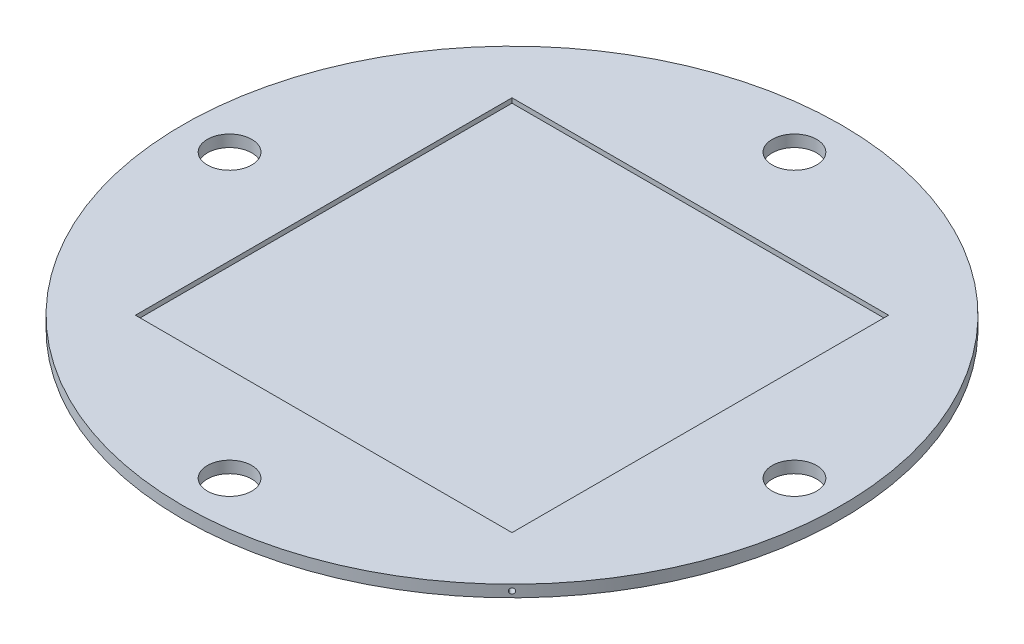
from build123d import *

# Parameters (mm, degrees)
SKETCH1_R           = 88.9
BOSS_EXTRUDE1_DEPTH = 3.175
SKETCH2_R           = 5.9944
CUT_EXTRUDE1_DEPTH  = 126.763669734
CIRPATTERN1_COUNT   = 4
SKETCH3_R           = 0.6985
CUT_EXTRUDE2_DEPTH  = 3.175
CIRPATTERN2_COUNT   = 4
SKETCH4_W           = 101.6
SKETCH4_H           = 101.6
CUT_EXTRUDE3_DEPTH  = 1.27


with BuildPart() as part:
    # Sketch1 → Boss-Extrude1 (new body)
    with BuildSketch(Plane(origin=(0, 0, 0), x_dir=(1, 0, 0), z_dir=(0, 1, 0))):
        Circle(SKETCH1_R)
    extrude(amount=BOSS_EXTRUDE1_DEPTH)

    # Sketch2 → Cut-Extrude1 (cut, through all)
    with BuildSketch(Plane(origin=(0, 3.175, 0), x_dir=(1, 0, 0), z_dir=(0, 1, 0))):
        with Locations((0, 76.2)):
            Circle(SKETCH2_R)
    cut_extrude1 = extrude(amount=-CUT_EXTRUDE1_DEPTH, mode=Mode.SUBTRACT)

    # CirPattern1: Cut-Extrude1 ×4 about axis
    cirpattern1_axis = Axis((0, 3.175, 0), (0, 1, 0))
    for i in range(1, CIRPATTERN1_COUNT):
        add(cut_extrude1.rotate(cirpattern1_axis, i * 360 / CIRPATTERN1_COUNT), mode=Mode.SUBTRACT)

    # Sketch3 → Cut-Extrude2 (cut)
    with BuildSketch(Plane(origin=(-62.861792847, 0, 62.861792847), x_dir=(0, -1, 0), z_dir=(-0.7071067811865488, 0, 0.7071067811865464))):
        with Locations((-1.5875, 0)):
            Circle(SKETCH3_R)
    cut_extrude2 = extrude(amount=-CUT_EXTRUDE2_DEPTH, mode=Mode.SUBTRACT)

    # CirPattern2: Cut-Extrude2 ×4 about axis
    cirpattern2_axis = Axis((0, 3.175, 0), (0, 1, 0))
    for i in range(1, CIRPATTERN2_COUNT):
        add(cut_extrude2.rotate(cirpattern2_axis, i * 360 / CIRPATTERN2_COUNT), mode=Mode.SUBTRACT)

    # Sketch4 → Cut-Extrude3 (cut)
    with BuildSketch(Plane(origin=(0, 3.175, 0), x_dir=(1, 0, 0), z_dir=(0, 1, 0))):
        Rectangle(SKETCH4_W, SKETCH4_H)
    extrude(amount=-CUT_EXTRUDE3_DEPTH, mode=Mode.SUBTRACT)


solid = part.part
